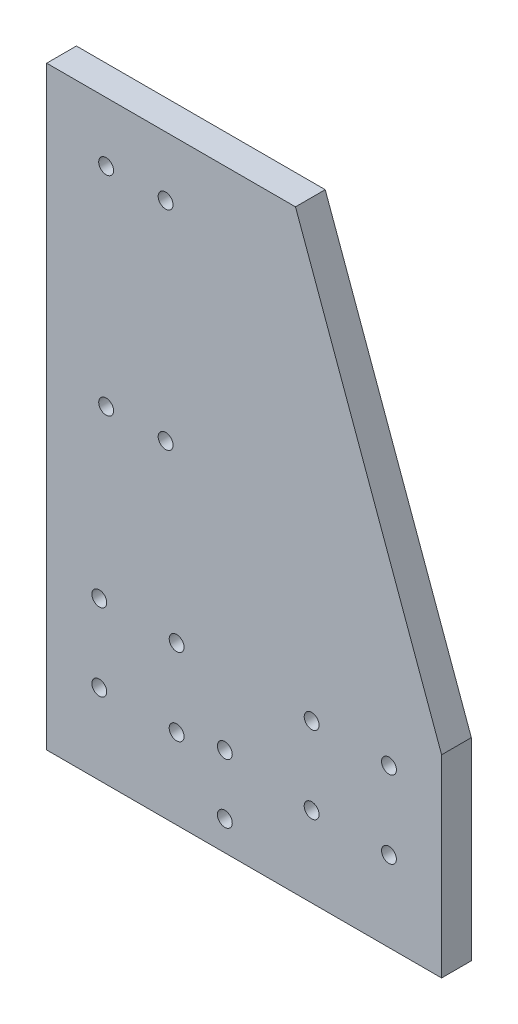
from build123d import *

# Parameters (mm, degrees)
SKETCH1_R           = 2.5
BOSS_EXTRUDE1_DEPTH = 10
SKETCH1_3_R         = 2.5
CUT_EXTRUDE1_DEPTH  = 5
SKETCH2_R           = 2.5
CUT_EXTRUDE2_DEPTH  = 241.282833344


with BuildPart() as part:
    # Sketch1 → Boss-Extrude1 (new body)
    with BuildSketch(Plane.XY):
        Polygon((0, 200), (0, 0), (132.8, 0), (132.8, 65), (83.664018374, 200), align=None)
        with Locations((17.7, 27)):
            Circle(SKETCH1_R, mode=Mode.SUBTRACT)
        with Locations((43.7, 27)):
            Circle(SKETCH1_R, mode=Mode.SUBTRACT)
        with Locations((17.7, 53)):
            Circle(SKETCH1_R, mode=Mode.SUBTRACT)
        with Locations((43.7, 53)):
            Circle(SKETCH1_R, mode=Mode.SUBTRACT)
        with Locations((89.1, 27)):
            Circle(SKETCH1_R, mode=Mode.SUBTRACT)
        with Locations((115.1, 27)):
            Circle(SKETCH1_R, mode=Mode.SUBTRACT)
        with Locations((89.1, 53)):
            Circle(SKETCH1_R, mode=Mode.SUBTRACT)
        with Locations((115.1, 53)):
            Circle(SKETCH1_R, mode=Mode.SUBTRACT)
        with Locations((59.91, 9.92)):
            Circle(SKETCH1_R, mode=Mode.SUBTRACT)
        with Locations((59.91, 29.92)):
            Circle(SKETCH1_R, mode=Mode.SUBTRACT)
    extrude(amount=BOSS_EXTRUDE1_DEPTH)

    # Sketch1<3> → Cut-Extrude1 (cut)
    # profile 1 of 2: a face of its own
    with BuildSketch(Plane.XY):
        Polygon((62.2225, 25.914632507), (64.535, 29.92), (62.2225, 33.925367493), (57.5975, 33.925367493), (55.285, 29.92), (57.5975, 25.914632507), align=None)
        with Locations((59.91, 29.92)):
            Circle(SKETCH1_3_R, mode=Mode.SUBTRACT)
    # profile 2 of 2: a face of its own
    with BuildSketch(Plane.XY):
        Polygon((64.535, 9.92), (62.2225, 13.925367493), (57.5975, 13.925367493), (55.285, 9.92), (57.5975, 5.914632507), (62.2225, 5.914632507), align=None)
        with Locations((59.91, 9.92)):
            Circle(SKETCH1_3_R, mode=Mode.SUBTRACT)
    extrude(amount=CUT_EXTRUDE1_DEPTH, mode=Mode.SUBTRACT)

    # Sketch2 → Cut-Extrude2 (cut, through all)
    with BuildSketch(Plane(origin=(0, 0, 0), x_dir=(-1, 0, 0), z_dir=(0, 0, -1))):
        with Locations((-40, 180)):
            Circle(SKETCH2_R)
        with Locations((-20, 180)):
            Circle(SKETCH2_R)
        with Locations((-40, 110)):
            Circle(SKETCH2_R)
        with Locations((-20, 110)):
            Circle(SKETCH2_R)
    extrude(amount=-CUT_EXTRUDE2_DEPTH, mode=Mode.SUBTRACT)


solid = part.part
